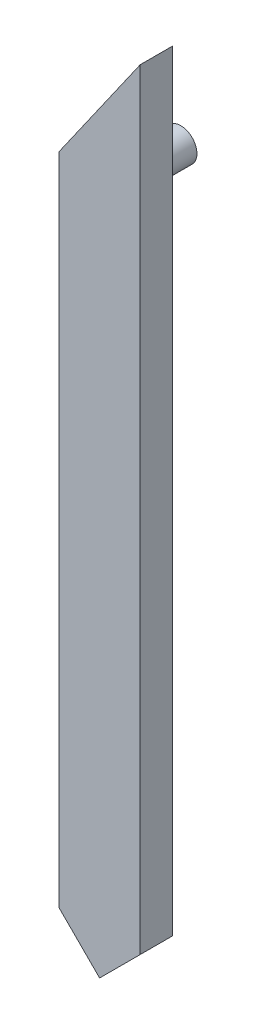
from build123d import *

# Parameters (mm, degrees)
SKETCH1_W           = 10
SKETCH1_H           = 100
BOSS_EXTRUDE1_DEPTH = 4
CUT_EXTRUDE1_DEPTH  = 4
CHAMFER1_SIZE       = 5
SKETCH3_R           = 2
BOSS_EXTRUDE2_DEPTH = 10


with BuildPart() as part:
    # Sketch1 → Boss-Extrude1 (new body)
    with BuildSketch(Plane.XY):
        Rectangle(SKETCH1_W, SKETCH1_H)
    extrude(amount=BOSS_EXTRUDE1_DEPTH)

    # Sketch2 → Cut-Extrude1 (cut)
    with BuildSketch(Plane.XY.offset(4)):
        Polygon((5, 50), (-5, 35.718519933), (-5, 50), align=None)
    extrude(amount=-CUT_EXTRUDE1_DEPTH, mode=Mode.SUBTRACT)

    # Chamfer1
    chamfer1_edges = [part.edges().sort_by_distance(p)[0] for p in [
        (-5, -50, 2),
        (5, -50, 2),
    ]]
    chamfer(chamfer1_edges, length=CHAMFER1_SIZE - 0.0001)  # a hair under: the kernel refuses the full size

    # Sketch3 → Boss-Extrude2 (add)
    with BuildSketch(Plane.XY.offset(4)):
        with Locations((0, 34)):
            Circle(SKETCH3_R)
    extrude(amount=-BOSS_EXTRUDE2_DEPTH)


solid = part.part
